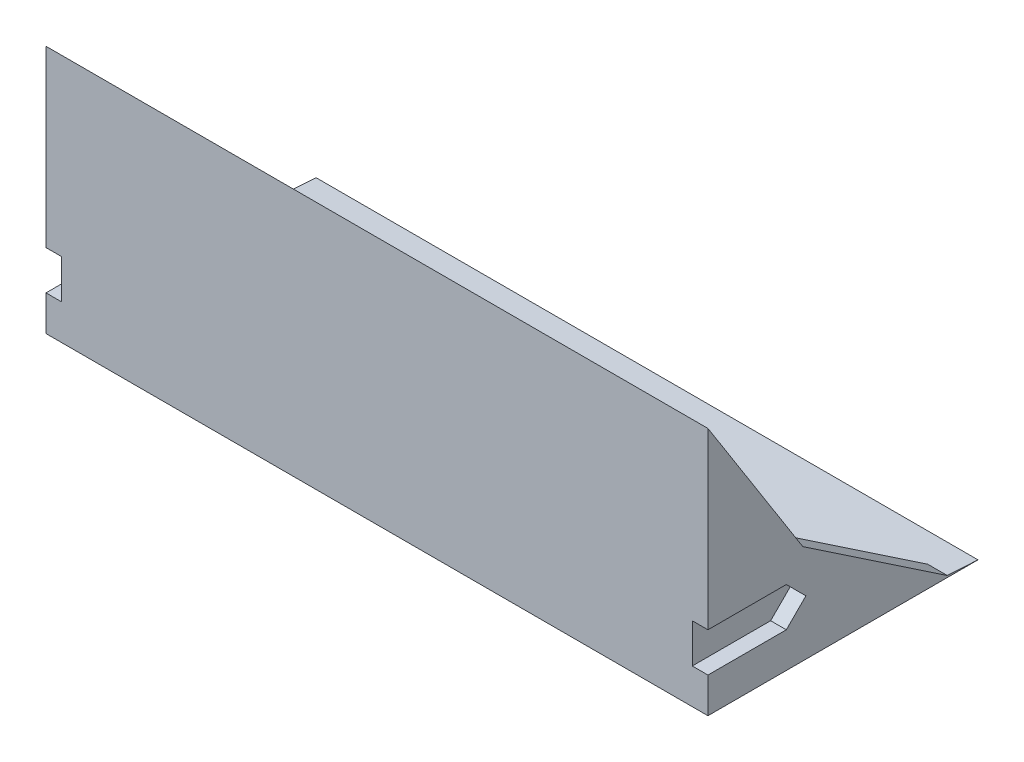
from build123d import *

# Parameters (mm, degrees)
BOSS_EXTRUDE1_DEPTH  = 84.455
BOSS_EXTRUDE2_DEPTH  = 5
FILLET2_R            = 15
CUT_EXTRUDE1_DEPTH   = 4
FILLET2_OF_MIRROR1_R = 15
FILLET1_START        = -79.455
FILLET1_DEPTH        = 158.91


with BuildPart() as part:
    # Sketch1 → Boss-Extrude1 (new, symmetric)
    with BuildSketch(Plane(origin=(0, 0, 0), x_dir=(0, 0, -1), z_dir=(1, 0, 0))):
        Polygon((0, 63.5), (0, 0), (68.9125, 0), (4, 4), align=None)
    extrude(amount=BOSS_EXTRUDE1_DEPTH, both=True)

    # Sketch2 → Boss-Extrude2 (add)
    with BuildSketch(Plane(origin=(84.455, 0, 0), x_dir=(0, 0, -1), z_dir=(1, 0, 0))):
        Polygon((0, 63.5), (24.219826303, 25.26657899), (61.769719172, 0), (0, 0), align=None)
    boss_extrude2 = extrude(amount=-BOSS_EXTRUDE2_DEPTH)

    # Fillet2
    fillet2_edges = [part.edges().sort_by_distance(p)[0] for p in [
        (79.455, 33.75, -2),
    ]]
    fillet(fillet2_edges, radius=FILLET2_R)

    # Sketch4 → Cut-Extrude1 (cut)
    with BuildSketch(Plane(origin=(84.455, 0, 0), x_dir=(0, 0, -1), z_dir=(1, 0, 0))):
        Polygon((0, 19), (20, 19), (25, 14), (20, 9), (0, 9), align=None)
    cut_extrude1 = extrude(amount=-CUT_EXTRUDE1_DEPTH, mode=Mode.SUBTRACT)

    # Mirror1: Boss-Extrude2, Cut-Extrude1 across plane
    add(boss_extrude2.mirror(Plane(origin=(0, 0, 0), x_dir=(0, 0, 1), z_dir=(1, 0, 0))))
    add(cut_extrude1.mirror(Plane(origin=(0, 0, 0), x_dir=(0, 0, 1), z_dir=(1, 0, 0))), mode=Mode.SUBTRACT)

    # Fillet2 of Mirror1
    fillet2_of_mirror1_edges = [part.edges().sort_by_distance(p)[0] for p in [
        (-79.455, 33.75, -2),
    ]]
    fillet(fillet2_of_mirror1_edges, radius=FILLET2_OF_MIRROR1_R)

    # Fillet1: read off the stored shape, not the designer's step
    # Fillet1 outline → Fillet1 (add)
    with BuildSketch(Plane.YZ.offset(FILLET1_START)):
        with BuildLine():
            Line((4, -4), (3.038172839, -19.608651391))
            add(Edge.make_bspline(
                [(3.038172839, -19.608651391), (4, -4), (36.630400727, -1.806359615)],
                knots=[0, 0, 0, 1, 1, 1], degree=2, weights=[1, 0.7511041, 1]))
            Line((36.630400727, -1.806359615), (4, -4))
        make_face()
    extrude(amount=FILLET1_DEPTH)


solid = part.part
